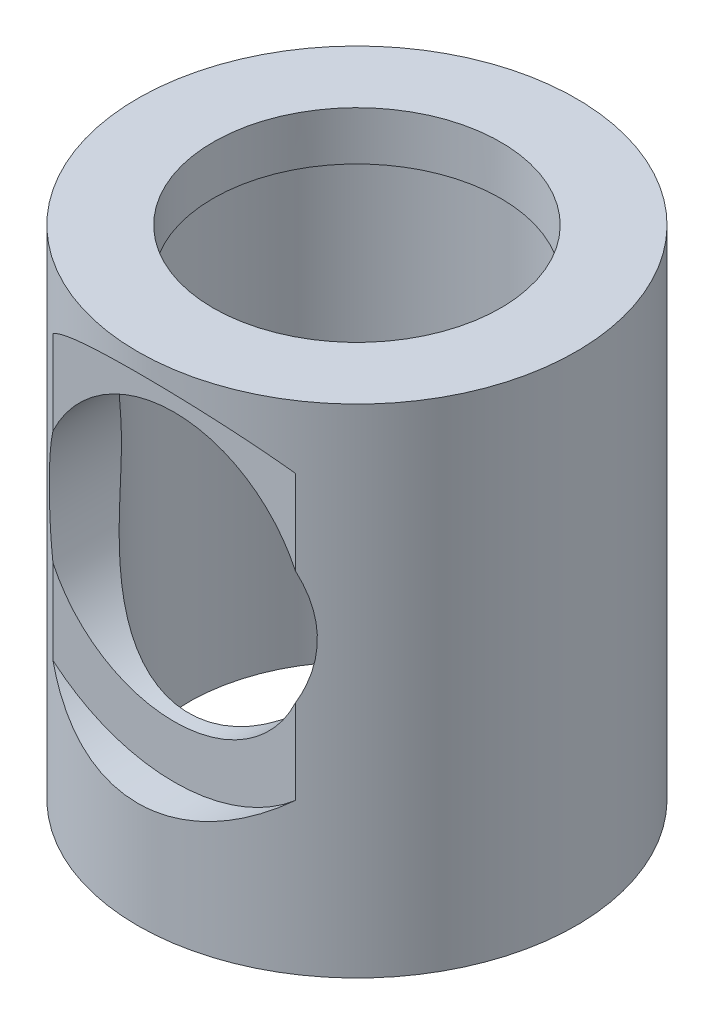
from build123d import *

# Parameters (mm, degrees)
SKETCH1_R               = 9
SKETCH1_R_2             = 5.9
BOSS_EXTRUDE1_DEPTH     = 20.4
CUT_EXTRUDE5_START      = 7.5
SKETCH3_R               = 7.65
CUT_EXTRUDE5_DEPTH      = 17.544957891
CUT_EXTRUDE6_DEPTH      = 28.738240917
CUT_EXTRUDE6_DEPTH_BACK = 7
SKETCH6_R               = 5.5
SKETCH7_R               = 6.9
CUT_EXTRUDE7_DEPTH      = 18.4


with BuildPart() as part:
    # Sketch1 → Boss-Extrude1 (new body)
    with BuildSketch(Plane(origin=(0, 0, 0), x_dir=(1, 0, 0), z_dir=(0, 1, 0))):
        Circle(SKETCH1_R)
        Circle(SKETCH1_R_2, mode=Mode.SUBTRACT)
    extrude(amount=-BOSS_EXTRUDE1_DEPTH)

    # Sketch3 → Cut-Extrude5 (cut, through all)
    with BuildSketch(Plane.XY.offset(CUT_EXTRUDE5_START)):
        with Locations((0, -8.4)):
            Circle(SKETCH3_R)
    extrude(amount=CUT_EXTRUDE5_DEPTH, mode=Mode.SUBTRACT)

    # Sketch6 → Cut-Extrude6 (cut, two sides: drawn at the far end of the back side and taken through both)
    with BuildSketch(Plane.XY.offset(7.5).offset(-CUT_EXTRUDE6_DEPTH_BACK)):
        with Locations((0, -8.4)):
            Circle(SKETCH6_R)
    extrude(amount=CUT_EXTRUDE6_DEPTH + CUT_EXTRUDE6_DEPTH_BACK, mode=Mode.SUBTRACT)

    # Sketch7 → Cut-Extrude7 (cut)
    with BuildSketch(Plane.XZ.offset(20.4)):
        Circle(SKETCH7_R)
    extrude(amount=-CUT_EXTRUDE7_DEPTH, mode=Mode.SUBTRACT)


solid = part.part
